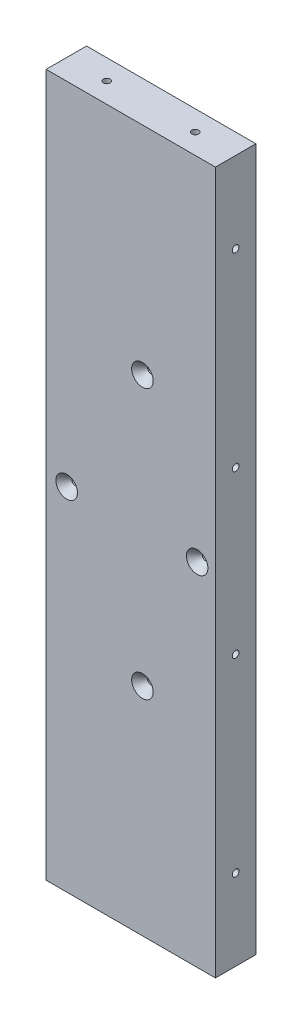
from build123d import *

# Parameters (mm, degrees)
SKETCH1_W           = 79.793650928
SKETCH1_H           = 330.949999988
BOSS_EXTRUDE1_DEPTH = 19.05
HOLE6_D             = 3.175
HOLE6_DEPTH         = 38.1
HOLE6_CSINK_D       = 10.16
HOLE6_CSINK_ANGLE   = 82
HOLE6_TIP           = 0.953866233
HOLE7_D             = 3.175
HOLE7_DEPTH         = 39.686133767
HOLE7_CSINK_D       = 10.16
HOLE7_CSINK_ANGLE   = 82
HOLE7_TIP           = 0.953866233
HOLE9_D             = 3.175
HOLE9_DEPTH         = 44.45
HOLE9_CSINK_D       = 10.16
HOLE9_CSINK_ANGLE   = 82
HOLE9_TIP           = 0.953866233


with BuildPart() as part:
    # Sketch1 → Boss-Extrude1 (new body)
    with BuildSketch(Plane.XY):
        with Locations((249.249792645, -72.024999997)):
            Rectangle(SKETCH1_W, SKETCH1_H)
    extrude(amount=BOSS_EXTRUDE1_DEPTH)

    # Hole6
    with Locations(Plane(origin=(308.196618109, -72.024999997, 609.909770337), x_dir=(0, -1, 0), z_dir=(1, 0, 0))):
        with Locations((81.549999997, 717.438633361), (-81.549999997, 717.438633361), (-81.549999997, 641.659770441), (-81.549999997, 793.217496281), (-174.999999994, 705.391438111), (-174.999999994, 329.112770337), (-174.999999994, 579.965215507), (-174.999999994, 454.538992941), (-174.999999994, 517.252104224), (-127.374999994, 600.384770441), (-38.1, 600.384770441), (-127.374999994, 376.737770337), (-38.1, 376.737770337), (38.1, 376.737770337), (127.374999994, 376.737770337), (38.1, 600.384770441), (127.374999994, 600.384770441), (174.999999994, 517.252104224), (174.999999994, 454.538992941), (174.999999994, 579.965215507), (174.999999994, 329.112770337), (174.999999994, 705.391438111), (81.549999997, 793.217496281), (81.549999997, 641.659770441)):
            CounterSinkHole(HOLE6_D / 2, HOLE6_CSINK_D / 2, depth=HOLE6_DEPTH, counter_sink_angle=HOLE6_CSINK_ANGLE)
            with Locations((0, 0, -(HOLE6_DEPTH + HOLE6_TIP / 2))):  # 118° drill point
                Cone(0, HOLE6_D / 2, HOLE6_TIP, mode=Mode.SUBTRACT)

    # Hole7
    with Locations(Plane(origin=(-181.039434513, 112.499999997, 386.262770337), x_dir=(0.9271838545667855, -1.3196841813264566e-15, -0.37460659341591657), z_dir=(0, 1, 0))):
        with Locations((546.331381686, 147.924742102), (34.861843518, 129.510688231), (398.711186007, 72.427013068), (25.409302346, 25.4), (393.709302346, 25.4), (604.536477781, 403.287242286), (643.194157759, 387.668525745), (520.756836983, 195.925354764), (559.414516961, 180.306638222), (507.673701708, 163.543458643)):
            CounterSinkHole(HOLE7_D / 2, HOLE7_CSINK_D / 2, depth=HOLE7_DEPTH, counter_sink_angle=HOLE7_CSINK_ANGLE)
            with Locations((0, 0, -(HOLE7_DEPTH + HOLE7_TIP / 2))):  # 118° drill point
                Cone(0, HOLE7_D / 2, HOLE7_TIP, mode=Mode.SUBTRACT)

    # Hole9
    with Locations(Plane(origin=(-181.039434513, -72.024999997, 19.05), x_dir=(0, -1, 0), z_dir=(0, 0, 1))):
        with Locations((63.5, 435.779526688), (-63.5, 435.779526688), (0, 461.558384256), (0, 400.075074406)):
            CounterSinkHole(HOLE9_D / 2, HOLE9_CSINK_D / 2, depth=HOLE9_DEPTH, counter_sink_angle=HOLE9_CSINK_ANGLE)
            with Locations((0, 0, -(HOLE9_DEPTH + HOLE9_TIP / 2))):  # 118° drill point
                Cone(0, HOLE9_D / 2, HOLE9_TIP, mode=Mode.SUBTRACT)


solid = part.part
